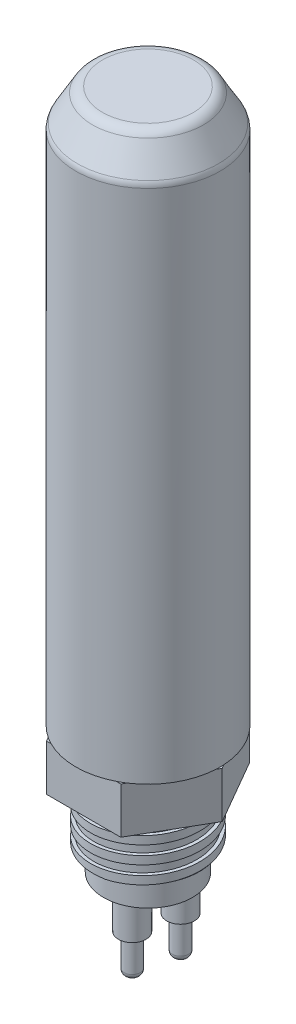
from build123d import *

# Parameters (mm, degrees)
BOSS_EXTRUDE1_DEPTH = 8
SKETCH3_R           = 9.5
BOSS_EXTRUDE2_DEPTH = 9.5
CUT_SWEEP1_PITCH    = 3
SKETCH14_R          = 7.7
BOSS_EXTRUDE3_DEPTH = 4.5
SKETCH15_R          = 2.4
BOSS_EXTRUDE4_DEPTH = 6
SKETCH16_R          = 1.4
BOSS_EXTRUDE5_DEPTH = 6.5
FILLET1_R           = 1
FILLET2_R           = 2


with BuildPart() as part:
    # Sketch1 → Revolve1 (revolve)
    with BuildSketch(Plane.XY, mode=Mode.PRIVATE) as revolve1_sk:
        Polygon((-12.5, 93.504923699), (-12.5, 3.504923699), (0, 3.504923699), (0, 99.504923699), (-9.049104672, 99.504923699), align=None)
    revolve(revolve1_sk.sketch.rotate(Axis((0, 0, 0), (0, 1, 0)), 180), axis=Axis((0, 0, 0), (0, 1, 0)))

    # Sketch2 → Boss-Extrude1 (add)
    with BuildSketch(Plane.XZ.offset(-3.504923699)):
        Polygon((12.874911003, 0), (6.437455501, 11.15), (-6.437455501, 11.15), (-12.874911003, 0), (-6.437455501, -11.15), (6.437455501, -11.15), align=None)
    extrude(amount=BOSS_EXTRUDE1_DEPTH)

    # Sketch3 → Boss-Extrude2 (add)
    with BuildSketch(Plane.XZ.offset(4.495076301)):
        with Locations(Location((0, 0, 0), (0, 0, 270))):
            Circle(SKETCH3_R)
    extrude(amount=BOSS_EXTRUDE2_DEPTH)

    # Cut-Sweep1: arcs per turn and ends read off the stored shape
    # Cut-Sweep1: the profile of 3DSketch1 profile screwed along a right-hand helix through 5 turns, 10 arcs to a turn; built about Z, then put on its axis
    cut_sweep1_z = Axis((0, 0, 0), (0, 0, 1))
    cut_sweep1_corners = [(9.5003, 0, -3.196719974), (8.922689725, 0, -3.196719974), (8.922689725, 0, -1.596719974), (9.5003, 0, -1.596719974)]
    with BuildLine(mode=Mode.PRIVATE) as cut_sweep1_profile:
        Line(cut_sweep1_corners[0], cut_sweep1_corners[1])
        Line(cut_sweep1_corners[1], cut_sweep1_corners[2])
        Line(cut_sweep1_corners[2], cut_sweep1_corners[3])
        Line(cut_sweep1_corners[3], cut_sweep1_corners[0])
    cut_sweep1_cap = Face(cut_sweep1_profile.wire())
    cut_sweep1_turn_angles = [0, 18, 36, 54, 72, 90, 108, 126, 144, 162, 180, 198, 216, 234, 252, 270, 288, 306, 324, 342, 360]
    cut_sweep1_turn_weights = [1, 0.9510565162951535, 1, 0.9510565162951535, 1, 0.9510565162951535, 1, 0.9510565162951535, 1, 0.9510565162951535, 1, 0.9510565162951535, 1, 0.9510565162951535, 1, 0.9510565162951535, 1, 0.9510565162951535, 1, 0.9510565162951535, 1]
    cut_sweep1_turn_rails = [Edge.make_bspline([Vector(p[0], p[1], 0).rotate(cut_sweep1_z, cut_sweep1_turn_angles[k]) / cut_sweep1_turn_weights[k] + Vector(0, 0, p[2] + CUT_SWEEP1_PITCH * cut_sweep1_turn_angles[k] / 360) for k in range(21)], [0, 0, 0, 1, 1, 2, 2, 3, 3, 4, 4, 5, 5, 6, 6, 7, 7, 8, 8, 9, 9, 10, 10, 10], 2, cut_sweep1_turn_weights) for p in cut_sweep1_corners]
    cut_sweep1_turn_sides = [Face.make_surface_from_curves(cut_sweep1_turn_rails[p[0]], cut_sweep1_turn_rails[p[1]]) for p in [(0, 1), (1, 2), (2, 3), (3, 0)]]
    cut_sweep1 = Plane(origin=(0, -13.995076301, 0), x_dir=(0, 0, -1), z_dir=(0, 1, 0)) * Solid(Shell([*[p.moved(Location((0, 0, CUT_SWEEP1_PITCH * i))) for i in range(5) for p in cut_sweep1_turn_sides], cut_sweep1_cap, cut_sweep1_cap.rotate(cut_sweep1_z, 1800).moved(Location((0, 0, CUT_SWEEP1_PITCH * 1800 / 360)))]))
    add(cut_sweep1, mode=Mode.SUBTRACT)

    # Sketch14 → Boss-Extrude3 (add)
    with BuildSketch(Plane.XZ.offset(13.995076301)):
        with Locations(Location((0, 0, 0), (0, 0, 270))):
            Circle(SKETCH14_R)
    extrude(amount=BOSS_EXTRUDE3_DEPTH)

    # Sketch15 → Boss-Extrude4 (add)
    with BuildSketch(Plane.XZ.offset(18.495076301)):
        with Locations(Location((1.558083021, 4.292165602, 0), (0, 0, 270))):
            Circle(SKETCH15_R)
        with Locations(Location((2.989300305, -2.657834398, 0), (0, 0, 270))):
            Circle(SKETCH15_R)
        with Locations(Location((-3.944680386, -2.186228866, 0), (0, 0, 270))):
            Circle(SKETCH15_R)
    extrude(amount=BOSS_EXTRUDE4_DEPTH)

    # Sketch16 → Boss-Extrude5 (add)
    with BuildSketch(Plane.XZ.offset(24.495076301)):
        with Locations(Location((-3.944680386, -2.186228866, 0), (0, 0, 90))):
            Circle(SKETCH16_R)
        with Locations(Location((2.989300305, -2.657834398, 0), (0, 0, 90))):
            Circle(SKETCH16_R)
        with Locations(Location((1.558083021, 4.292165602, 0), (0, 0, 90))):
            Circle(SKETCH16_R)
    extrude(amount=BOSS_EXTRUDE5_DEPTH)

    # Fillet1
    fillet1_edges = [part.edges().sort_by_distance(p)[0] for p in [
        (-3.944680386, -30.995076301, -3.586228866),
        (2.989300305, -30.995076301, -4.057834398),
        (1.558083021, -30.995076301, 2.892165602),
    ]]
    fillet(fillet1_edges, radius=FILLET1_R)

    # Fillet2
    fillet2_edges = [part.edges().sort_by_distance(p)[0] for p in [
        (-12.5, 93.504923699, 0),
        (-9.049104672, 99.504923699, 0),
    ]]
    fillet(fillet2_edges, radius=FILLET2_R)


solid = part.part
